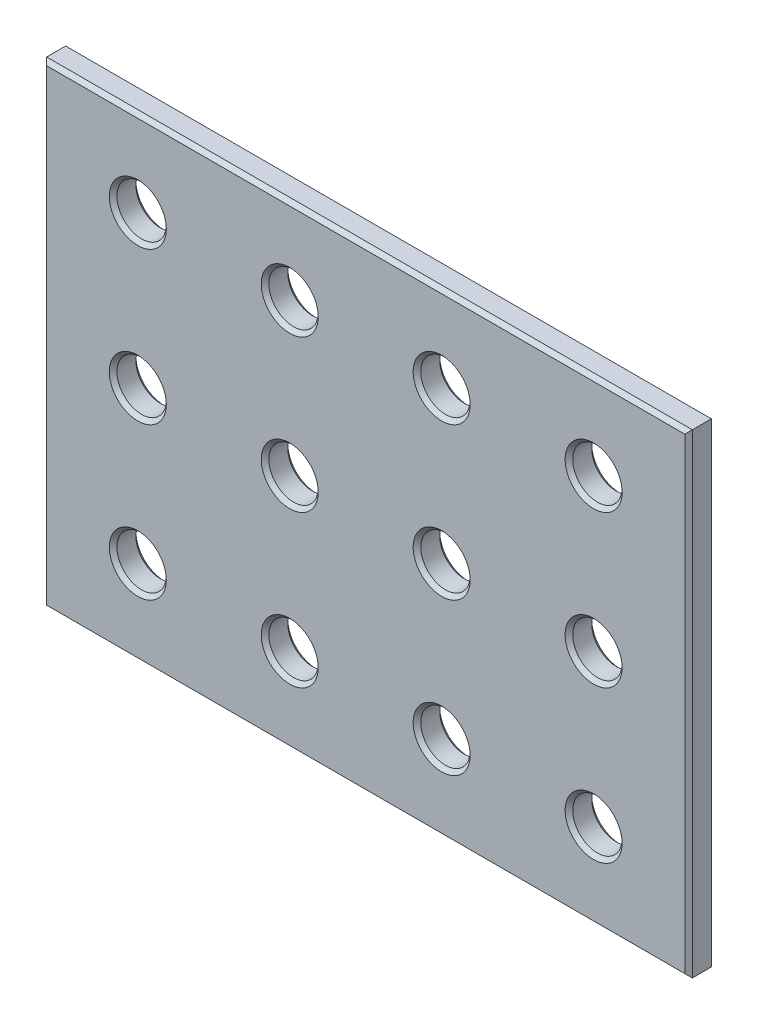
from build123d import *

# Parameters (mm, degrees)
SKETCH_1_W        = 340
SKETCH_1_H        = 250
SKETCH_1_R        = 13
EXTRUDE_406_DEPTH = 14
CHAMFER_1_SIZE    = 2


with BuildPart() as part:
    # 草图1 → Extrude 406 (new body)
    with BuildSketch(Plane.XY):
        Rectangle(SKETCH_1_W, SKETCH_1_H)
        with Locations((-120, 80)):
            Circle(SKETCH_1_R, mode=Mode.SUBTRACT)
        with Locations((-40, 80)):
            Circle(SKETCH_1_R, mode=Mode.SUBTRACT)
        with Locations((-40, 0)):
            Circle(SKETCH_1_R, mode=Mode.SUBTRACT)
        with Locations((-120, 0)):
            Circle(SKETCH_1_R, mode=Mode.SUBTRACT)
        with Locations((-40, -80)):
            Circle(SKETCH_1_R, mode=Mode.SUBTRACT)
        with Locations((-120, -80)):
            Circle(SKETCH_1_R, mode=Mode.SUBTRACT)
        with Locations((120, -80)):
            Circle(SKETCH_1_R, mode=Mode.SUBTRACT)
        with Locations((40, -80)):
            Circle(SKETCH_1_R, mode=Mode.SUBTRACT)
        with Locations((120, 0)):
            Circle(SKETCH_1_R, mode=Mode.SUBTRACT)
        with Locations((40, 0)):
            Circle(SKETCH_1_R, mode=Mode.SUBTRACT)
        with Locations((40, 80)):
            Circle(SKETCH_1_R, mode=Mode.SUBTRACT)
        with Locations((120, 80)):
            Circle(SKETCH_1_R, mode=Mode.SUBTRACT)
    extrude(amount=EXTRUDE_406_DEPTH)

    # 倒角1
    chamfer_1_edges = [part.edges().sort_by_distance(p)[0] for p in [
        (107, 80, 0),
        (27, 0, 0),
        (27, -80, 0),
        (-133, -80, 0),
        (-133, 0, 0),
        (-53, 80, 0),
        (0, -125, 0),
        (170, 0, 0),
        (0, 125, 0),
        (-170, 0, 0),
        (-133, 80, 0),
        (-53, 0, 0),
        (-53, -80, 0),
        (107, -80, 0),
        (107, 0, 0),
        (27, 80, 0),
        (107, 80, 14),
        (27, 0, 14),
        (27, -80, 14),
        (-133, -80, 14),
        (-133, 0, 14),
        (-53, 80, 14),
        (0, 125, 14),
        (170, 0, 14),
        (0, -125, 14),
        (-170, 0, 14),
        (-133, 80, 14),
        (-53, 0, 14),
        (-53, -80, 14),
        (107, -80, 14),
        (107, 0, 14),
        (27, 80, 14),
    ]]
    chamfer(chamfer_1_edges, length=CHAMFER_1_SIZE)


solid = part.part
